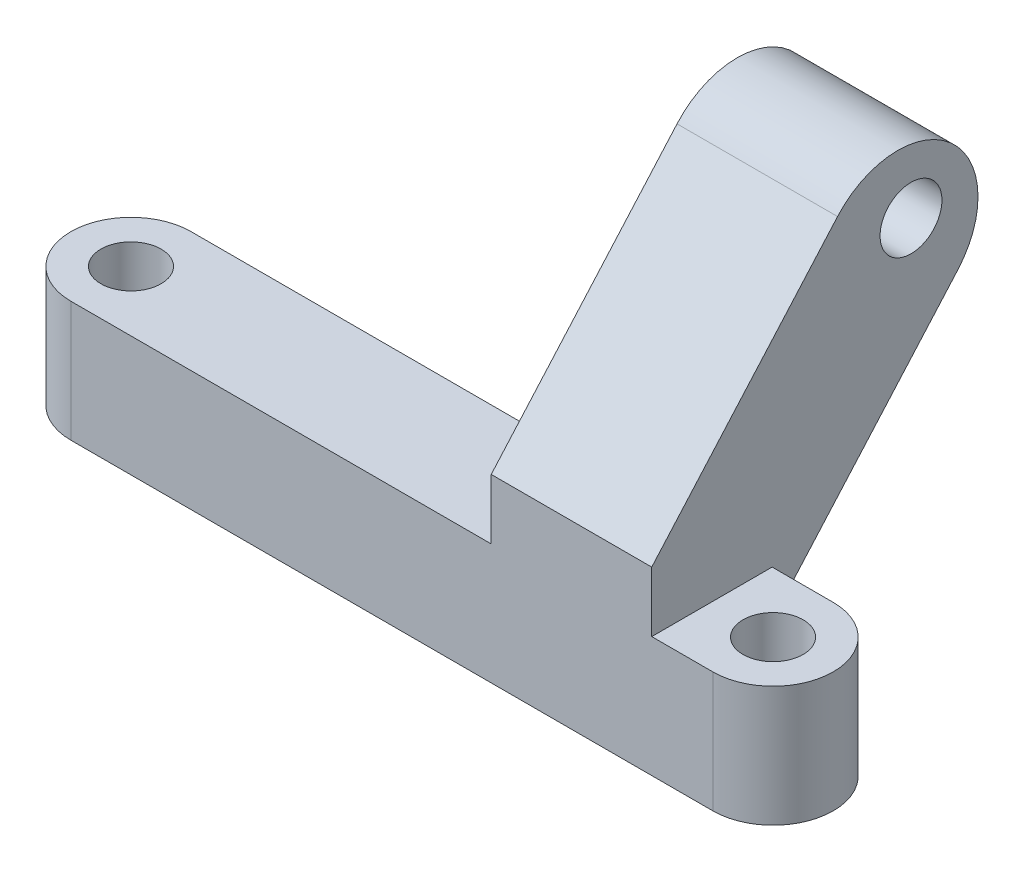
from build123d import *

# Parameters (mm, degrees)
SKETCH_1_R          = 1.5
EXTRUDE_2_DEPTH     = 6
SKETCH_1_4_W        = 8
SKETCH_1_4_H        = 6
EXTRUDE_3_DEPTH     = 3
EXTRUDE_28_DEPTH    = 8
SKETCH_8_R          = 1.542364341
CUT_EXTRUDE_2_DEPTH = 12


with BuildPart() as part:
    # 草圖1 → 填料-伸長2 (new body)
    with BuildSketch(Plane(origin=(0, 0, 0), x_dir=(1, 0, 0), z_dir=(0, 1, 0))):
        with BuildLine():
            Line((-38.676968887, -3), (-6.676968887, -3))
            ThreePointArc((-6.676968887, -3), (-3.676968887, 0), (-6.676968887, 3))
            Line((-6.676968887, 3), (-38.676968887, 3))
            ThreePointArc((-38.676968887, 3), (-41.676968887, 0), (-38.676968887, -3))
        make_face()
        with Locations((-38.676968887, 0)):
            Circle(SKETCH_1_R, mode=Mode.SUBTRACT)
        with Locations((-6.676968887, 0)):
            Circle(SKETCH_1_R, mode=Mode.SUBTRACT)
    extrude(amount=-EXTRUDE_2_DEPTH)

    # 草圖1<4> → 填料-伸長3 (add)
    with BuildSketch(Plane(origin=(0, 0, 0), x_dir=(1, 0, 0), z_dir=(0, 1, 0))):
        with Locations((-13.722758256, 0)):
            Rectangle(SKETCH_1_4_W, SKETCH_1_4_H)
    extrude(amount=EXTRUDE_3_DEPTH)

    # 草圖3 → 填料-伸長28 (add)
    with BuildSketch(Plane(origin=(-9.722758256, 0, 0), x_dir=(0, 0, -1), z_dir=(1, 0, 0))):
        with BuildLine():
            Line((3, -2.291502622), (12.260129589, 8.208497378))
            ThreePointArc((12.260129589, 8.208497378), (11.9058809, 13.854248689), (6.260129589, 13.5))
            Line((6.260129589, 13.5), (-3, 3))
            Line((-3, 3), (3, -2.291502622))
        make_face()
    extrude(amount=-EXTRUDE_28_DEPTH)

    # 草圖8 → 除料-伸長2 (cut)
    with BuildSketch(Plane(origin=(-9.722758256, 0, 0), x_dir=(0, 0, -1), z_dir=(1, 0, 0))):
        with Locations((9.921567416, 11.604248689)):
            Circle(SKETCH_8_R)
    extrude(amount=-CUT_EXTRUDE_2_DEPTH, mode=Mode.SUBTRACT)


solid = part.part
